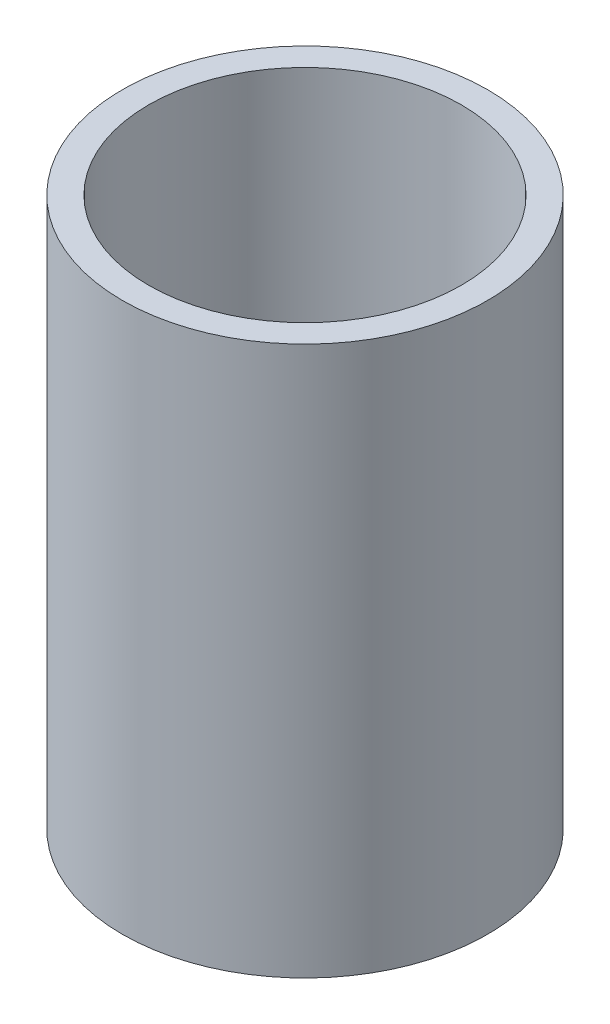
from build123d import *

# Parameters (mm, degrees)
SKETCH1_R           = 35
BOSS_EXTRUDE1_DEPTH = 105.227514019
SKETCH2_R           = 29.967893887
CUT_EXTRUDE1_DEPTH  = 117.287702301


with BuildPart() as part:
    # Sketch1 → Boss-Extrude1 (new body)
    with BuildSketch(Plane(origin=(0, 0, 0), x_dir=(1, 0, 0), z_dir=(0, 1, 0))):
        Circle(SKETCH1_R)
    extrude(amount=BOSS_EXTRUDE1_DEPTH)

    # Sketch2 → Cut-Extrude1 (cut, through all)
    with BuildSketch(Plane(origin=(0, 0, 0), x_dir=(1, 0, 0), z_dir=(0, 1, 0))):
        Circle(SKETCH2_R)
    extrude(amount=CUT_EXTRUDE1_DEPTH, mode=Mode.SUBTRACT)


solid = part.part
